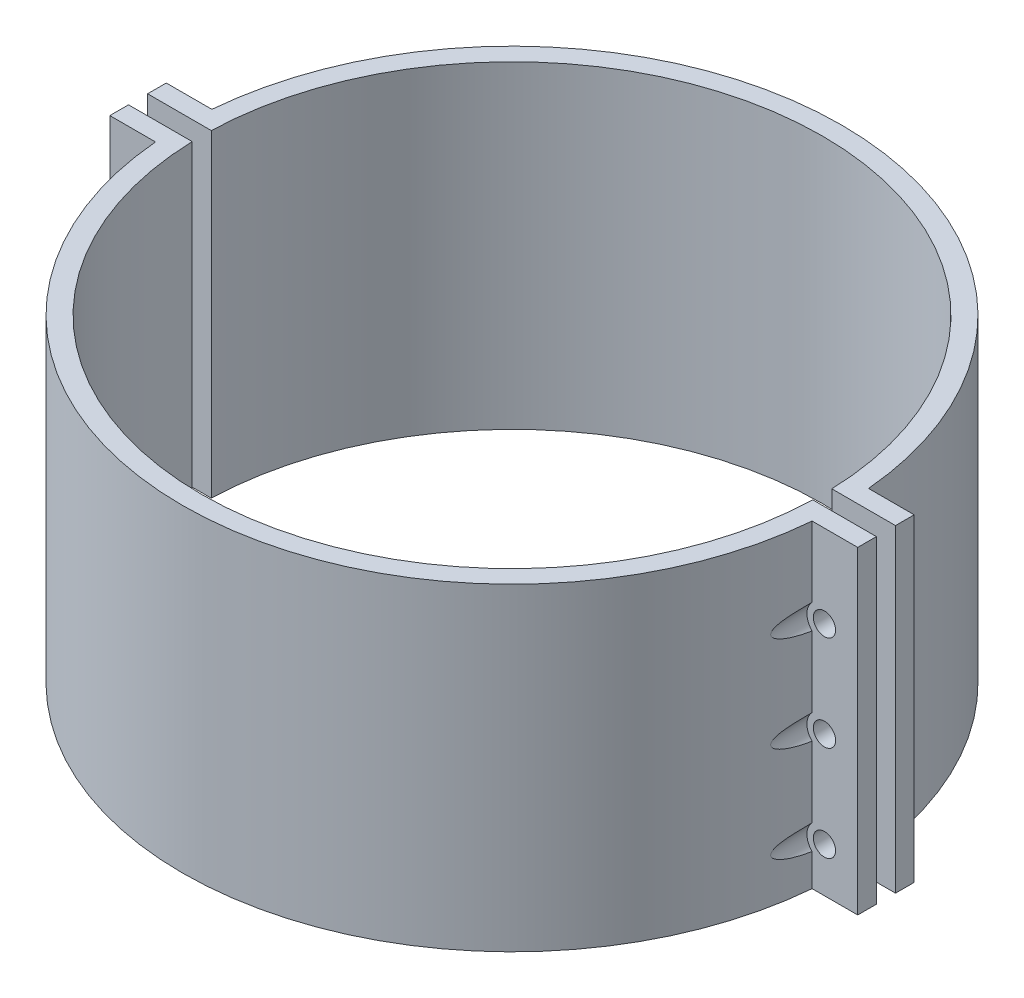
from build123d import *

# Parameters (mm, degrees)
BOSS_EXTRUDE1_DEPTH   = 50
BOSS_EXTRUDE1_2_DEPTH = 50
SKETCH2_R             = 1.75
CUT_EXTRUDE1_DEPTH    = 96.421557242
CUT_EXTRUDE3_START    = 50
SKETCH3_R             = 2.75
SKETCH3_R_2           = 1.75
CUT_EXTRUDE3_DEPTH    = 50
SKETCH5_R             = 2.75
SKETCH5_R_2           = 1.75
CUT_EXTRUDE4_DEPTH    = 50


with BuildPart() as part:
    # Sketch1 → Boss-Extrude1 (new body)
    with BuildSketch(Plane(origin=(0, 0, 0), x_dir=(1, 0, 0), z_dir=(0, 1, 0))):
        with BuildLine():
            Line((-48.726917612, -1.5), (-58.726917612, -1.5))
            Line((-58.726917612, -1.5), (-58.726917612, -4.432049928))
            Line((-58.726917612, -4.432049928), (-51.55986262, -4.432049928))
            ThreePointArc((-51.55986262, -4.432049928), (0, -51.75), (51.55986262, -4.432049928))
            Line((51.55986262, -4.432049928), (58.726917612, -4.432049928))
            Line((58.726917612, -4.432049928), (58.726917612, -1.5))
            Line((58.726917612, -1.5), (48.726917612, -1.5))
            ThreePointArc((48.726917612, -1.5), (0, -48.75), (-48.726917612, -1.5))
        make_face()
    extrude(amount=BOSS_EXTRUDE1_DEPTH)


with BuildPart() as body_2:
    # Sketch1 → Boss-Extrude1 2 (new body)
    with BuildSketch(Plane(origin=(0, 0, 0), x_dir=(1, 0, 0), z_dir=(0, 1, 0))):
        with BuildLine():
            Line((-58.726917612, 4.432049928), (-58.726917612, 1.5))
            Line((-58.726917612, 1.5), (-48.726917612, 1.5))
            ThreePointArc((-48.726917612, 1.5), (0, 48.75), (48.726917612, 1.5))
            Line((48.726917612, 1.5), (58.726917612, 1.5))
            Line((58.726917612, 1.5), (58.726917612, 4.432049928))
            Line((58.726917612, 4.432049928), (51.55986262, 4.432049928))
            ThreePointArc((51.55986262, 4.432049928), (0, 51.75), (-51.55986262, 4.432049928))
            Line((-51.55986262, 4.432049928), (-58.726917612, 4.432049928))
        make_face()
    extrude(amount=BOSS_EXTRUDE1_2_DEPTH)


with BuildPart() as cut_extrude1_tool:
    # Sketch2 → Cut-Extrude1 (new, through all)
    with BuildSketch(Plane.XY.offset(4.432049928)):
        with Locations((-53.5, 7)):
            Circle(SKETCH2_R)
        with Locations((-53.5, 22)):
            Circle(SKETCH2_R)
        with Locations((-53.5, 37)):
            Circle(SKETCH2_R)
        with Locations((53.5, 7)):
            Circle(SKETCH2_R)
        with Locations((53.5, 22)):
            Circle(SKETCH2_R)
        with Locations((53.5, 37)):
            Circle(SKETCH2_R)
    extrude(amount=-CUT_EXTRUDE1_DEPTH)


with BuildPart() as part_1:
    add(part.part)

    # Cut-Extrude1: cut by cut_extrude1_tool
    add(cut_extrude1_tool.part, mode=Mode.SUBTRACT)

    # Sketch3 → Cut-Extrude3 (cut)
    # profile 1 of 6: a face of its own
    with BuildSketch(Plane.XY.offset(4.432049928).offset(CUT_EXTRUDE3_START)):
        with Locations((-53.5, 37)):
            Circle(SKETCH3_R)
        with Locations((-53.5, 37)):
            Circle(SKETCH3_R_2, mode=Mode.SUBTRACT)
    # profile 2 of 6: a face of its own
    with BuildSketch(Plane.XY.offset(4.432049928).offset(CUT_EXTRUDE3_START)):
        with Locations((-53.5, 22)):
            Circle(SKETCH3_R)
        with Locations((-53.5, 22)):
            Circle(SKETCH3_R_2, mode=Mode.SUBTRACT)
    # profile 3 of 6: a face of its own
    with BuildSketch(Plane.XY.offset(4.432049928).offset(CUT_EXTRUDE3_START)):
        with Locations((-53.5, 7)):
            Circle(SKETCH3_R)
        with Locations((-53.5, 7)):
            Circle(SKETCH3_R_2, mode=Mode.SUBTRACT)
    # profile 4 of 6: a face of its own
    with BuildSketch(Plane.XY.offset(4.432049928).offset(CUT_EXTRUDE3_START)):
        with Locations((53.5, 7)):
            Circle(SKETCH3_R)
        with Locations((53.5, 7)):
            Circle(SKETCH3_R_2, mode=Mode.SUBTRACT)
    # profile 5 of 6: a face of its own
    with BuildSketch(Plane.XY.offset(4.432049928).offset(CUT_EXTRUDE3_START)):
        with Locations((53.5, 22)):
            Circle(SKETCH3_R)
        with Locations((53.5, 22)):
            Circle(SKETCH3_R_2, mode=Mode.SUBTRACT)
    # profile 6 of 6: a face of its own
    with BuildSketch(Plane.XY.offset(4.432049928).offset(CUT_EXTRUDE3_START)):
        with Locations((53.5, 37)):
            Circle(SKETCH3_R)
        with Locations((53.5, 37)):
            Circle(SKETCH3_R_2, mode=Mode.SUBTRACT)
    extrude(amount=-CUT_EXTRUDE3_DEPTH, mode=Mode.SUBTRACT)


with BuildPart() as body_2_1:
    add(body_2.part)

    # Cut-Extrude1: cut by cut_extrude1_tool
    add(cut_extrude1_tool.part, mode=Mode.SUBTRACT)

    # Sketch5 → Cut-Extrude4 (cut)
    # profile 1 of 6: a face of its own
    with BuildSketch(Plane(origin=(0, 0, -4.432049928), x_dir=(-1, 0, 0), z_dir=(0, 0, -1))):
        with Locations((-53.5, 37)):
            Circle(SKETCH5_R)
        with Locations((-53.5, 37)):
            Circle(SKETCH5_R_2, mode=Mode.SUBTRACT)
    # profile 2 of 6: a face of its own
    with BuildSketch(Plane(origin=(0, 0, -4.432049928), x_dir=(-1, 0, 0), z_dir=(0, 0, -1))):
        with Locations((-53.5, 22)):
            Circle(SKETCH5_R)
        with Locations((-53.5, 22)):
            Circle(SKETCH5_R_2, mode=Mode.SUBTRACT)
    # profile 3 of 6: a face of its own
    with BuildSketch(Plane(origin=(0, 0, -4.432049928), x_dir=(-1, 0, 0), z_dir=(0, 0, -1))):
        with Locations((-53.5, 7)):
            Circle(SKETCH5_R)
        with Locations((-53.5, 7)):
            Circle(SKETCH5_R_2, mode=Mode.SUBTRACT)
    # profile 4 of 6: a face of its own
    with BuildSketch(Plane(origin=(0, 0, -4.432049928), x_dir=(-1, 0, 0), z_dir=(0, 0, -1))):
        with Locations((53.5, 7)):
            Circle(SKETCH5_R)
        with Locations((53.5, 7)):
            Circle(SKETCH5_R_2, mode=Mode.SUBTRACT)
    # profile 5 of 6: a face of its own
    with BuildSketch(Plane(origin=(0, 0, -4.432049928), x_dir=(-1, 0, 0), z_dir=(0, 0, -1))):
        with Locations((53.5, 22)):
            Circle(SKETCH5_R)
        with Locations((53.5, 22)):
            Circle(SKETCH5_R_2, mode=Mode.SUBTRACT)
    # profile 6 of 6: a face of its own
    with BuildSketch(Plane(origin=(0, 0, -4.432049928), x_dir=(-1, 0, 0), z_dir=(0, 0, -1))):
        with Locations((53.5, 37)):
            Circle(SKETCH5_R)
        with Locations((53.5, 37)):
            Circle(SKETCH5_R_2, mode=Mode.SUBTRACT)
    extrude(amount=CUT_EXTRUDE4_DEPTH, mode=Mode.SUBTRACT)


solid = Compound([part_1.part, body_2_1.part])
